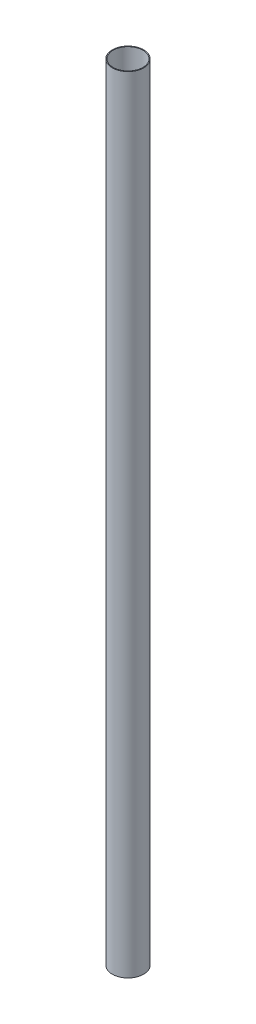
from build123d import *

# Parameters (mm, degrees)
SKETCH_1_R      = 20
SKETCH_1_R_2    = 19
EXTRUDE_1_DEPTH = 1000


with BuildPart() as part:
    # Эскиз1 → Бобышка-Вытянуть1 (new body)
    with BuildSketch(Plane(origin=(0, 0, 0), x_dir=(1, 0, 0), z_dir=(0, 1, 0))):
        Circle(SKETCH_1_R)
        Circle(SKETCH_1_R_2, mode=Mode.SUBTRACT)
    extrude(amount=EXTRUDE_1_DEPTH)


solid = part.part
